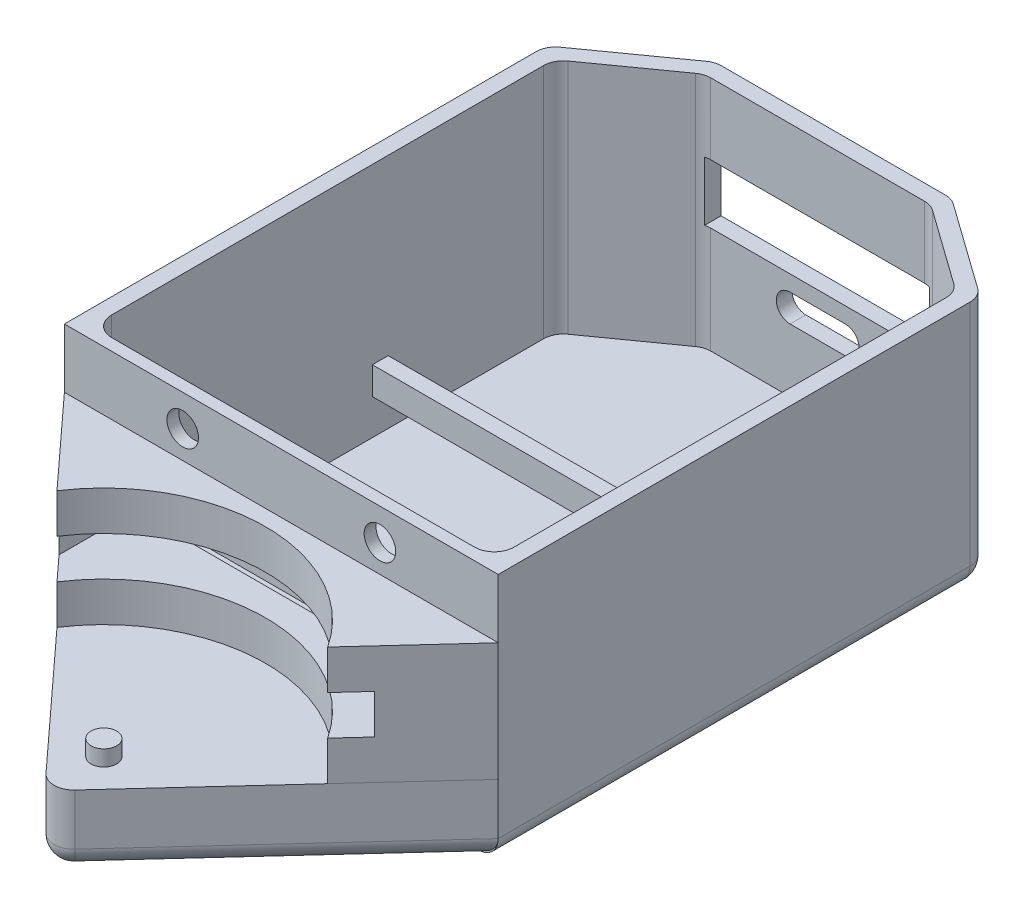
from build123d import *

# Parameters (mm, degrees)
BOSS_EXTRUDE1_DEPTH      = 60
BOSS_EXTRUDE2_DEPTH      = 3
BOSS_EXTRUDE3_START      = 9
SKETCH4_W                = 102
SKETCH4_H                = 4
BOSS_EXTRUDE3_DEPTH      = 7
BOSS_EXTRUDE9_DEPTH      = 15
BOSS_EXTRUDE10_DEPTH     = 18
SKETCH8_W                = 57
SKETCH8_H                = 15
CUT_EXTRUDE1_DEPTH       = 4
SKETCH9_R                = 3.25
BOSS_EXTRUDE11_DEPTH     = 4
SKETCH12_W               = 80
SKETCH12_H               = 10
CUT_EXTRUDE3_DEPTH       = 168.119840074
SKETCH11_R               = 4
CUT_EXTRUDE2_DEPTH       = 4
CUT_EXTRUDE5_START       = -2
CUT_EXTRUDE5_OUTLINE_W   = 100.431415377
CUT_EXTRUDE5_OUTLINE_H   = 30.721398403
CUT_EXTRUDE5_OUTLINE_W_2 = 94.581049407
CUT_EXTRUDE5_OUTLINE_H_2 = 24.546499388
CUT_EXTRUDE5_OUTLINE_W_3 = 3.095406047
CUT_EXTRUDE5_OUTLINE_H_3 = 17.175789186
CUT_EXTRUDE5_OUTLINE_W_4 = 2.748789672
CUT_EXTRUDE5_OUTLINE_H_4 = 2.748789672
CUT_EXTRUDE5_DEPTH       = 2
FILLET1_R                = 5
FILLET2_R                = 5


# Read off the part's stored shape, not the designer's step: Cut-Extrude5
with BuildPart() as part:
    # Sketch2 → Boss-Extrude1 (new body)
    with BuildSketch(Plane(origin=(0, 0, 0), x_dir=(1, 0, 0), z_dir=(0, 1, 0))):
        Polygon((-10.434317904, 0), (49.565682096, 0), (74.565682096, -17.842873744), (74.565682096, -140), (-35.434317904, -140), (-35.434317904, -17.842873744), align=None)
        Polygon((-31.434317904, -19.902301734), (-9.153291369, -4), (48.284655561, -4), (70.565682096, -19.902301734), (70.565682096, -137), (-31.434317904, -137), align=None, mode=Mode.SUBTRACT)
    extrude(amount=BOSS_EXTRUDE1_DEPTH)

    # Sketch3 → Boss-Extrude2 (add)
    with BuildSketch(Plane(origin=(0, 0, 0), x_dir=(1, 0, 0), z_dir=(0, 1, 0))):
        Polygon((-35.434317904, -17.842873744), (-10.434317904, 0), (49.565682096, 0), (74.565682096, -17.842873744), (74.565682096, -140), (-35.434317904, -140), align=None)
    extrude(amount=-BOSS_EXTRUDE2_DEPTH)

    # Sketch4 → Boss-Extrude3 (add)
    with BuildSketch(Plane(origin=(0, 0, 0), x_dir=(1, 0, 0), z_dir=(0, 1, 0)).offset(BOSS_EXTRUDE3_START)):
        with Locations((19.565682096, -63.902301734)):
            Rectangle(SKETCH4_W, SKETCH4_H)
        with Locations((19.565682096, -117.902301734)):
            Rectangle(SKETCH4_W, SKETCH4_H)
    extrude(amount=BOSS_EXTRUDE3_DEPTH)

    # Sketch5 → Boss-Extrude9 (add, symmetric)
    with BuildSketch(Plane(origin=(0, 30, 0), x_dir=(1, 0, 0), z_dir=(0, 1, 0))):
        with BuildLine():
            Line((74.565682096, -140), (-35.434317904, -140))
            Line((-35.434317904, -140), (-14.750780256, -162.563859252))
            ThreePointArc((-14.750780256, -162.563859252), (19.565682096, -144), (53.882144448, -162.563859252))
            Line((53.882144448, -162.563859252), (74.565682096, -140))
        make_face()
    extrude(amount=BOSS_EXTRUDE9_DEPTH, both=True)

    # Sketch8 → Cut-Extrude1 (cut)
    with BuildSketch(Plane(origin=(0, 0, 0), x_dir=(-1, 0, 0), z_dir=(0, 0, -1))):
        with BuildLine():
            Line((-26.565682096, 23), (-12.565682096, 23))
            ThreePointArc((-12.565682096, 23), (-9.065682096, 19.5), (-12.565682096, 16))
            Line((-12.565682096, 16), (-26.565682096, 16))
            ThreePointArc((-26.565682096, 16), (-30.065682096, 19.5), (-26.565682096, 23))
        make_face()
        with Locations((-19.565682096, 34.5)):
            Rectangle(SKETCH8_W, SKETCH8_H)
    extrude(amount=-CUT_EXTRUDE1_DEPTH, mode=Mode.SUBTRACT)

    # Sketch12 → Cut-Extrude3 (cut, through all)
    with BuildSketch(Plane(origin=(0, 0, 137), x_dir=(-1, 0, 0), z_dir=(0, 0, -1))):
        with Locations((-19.565682096, 30)):
            Rectangle(SKETCH12_W, SKETCH12_H)
    extrude(amount=-CUT_EXTRUDE3_DEPTH, mode=Mode.SUBTRACT)

    # Sketch11 → Cut-Extrude2 (cut)
    with BuildSketch(Plane.XY.offset(140)):
        with Locations((-5.434317904, 52)):
            Circle(SKETCH11_R)
        with Locations((44.565682096, 52)):
            Circle(SKETCH11_R)
    extrude(amount=-CUT_EXTRUDE2_DEPTH, mode=Mode.SUBTRACT)

    # Cut-Extrude5 outline → Cut-Extrude5 (cut)
    # profile 1 of 9: a face of its own
    with BuildSketch(Plane.ZY.offset(35.434317904).offset(CUT_EXTRUDE5_START)):
        with Locations((78.641400006, 30.905163363)):
            Rectangle(CUT_EXTRUDE5_OUTLINE_W, CUT_EXTRUDE5_OUTLINE_H)
        with Locations((78.641400007, 31.083776144)):
            Rectangle(CUT_EXTRUDE5_OUTLINE_W_2, CUT_EXTRUDE5_OUTLINE_H_2, mode=Mode.SUBTRACT)
    # profile 2 of 9: a face of its own
    with BuildSketch(Plane.ZY.offset(35.434317904).offset(CUT_EXTRUDE5_START)):
        with BuildLine():
            add(Edge.make_bspline(
                [(102.014179182, 30.804972607), (100.965453341, 29.831756752), (99.635974179, 29.345328611), (98.025382124, 29.345328611)],
                knots=[6, 6, 6, 6, 7, 7, 7, 7], degree=3))
            add(Edge.make_bspline(
                [(103.587088158, 34.617615654), (103.587088158, 33.048877706), (103.062689281, 31.777972719), (102.014179182, 30.804972607)],
                knots=[5, 5, 5, 5, 6, 6, 6, 6], degree=3))
            add(Edge.make_bspline(
                [(103.58708704, 34.620730481), (103.587087139, 34.61969235), (103.587087229, 34.618654074), (103.587088158, 34.617615654)],
                knots=[4.97598677, 4.97598677, 4.97598677, 4.97598677, 4.978108927, 4.978108927, 4.978108927, 4.978108927], degree=3))
            add(Edge.make_bspline(
                [(102.133700704, 38.197436242), (103.101870347, 37.187264435), (103.586356473, 35.995065057), (103.58708704, 34.620730481)],
                knots=[4, 4, 4, 4, 4.999245171, 4.999245171, 4.999245171, 4.999245171], degree=3))
            add(Edge.make_bspline(
                [(102.128179158, 38.203185617), (102.13001779, 38.201267335), (102.131856383, 38.199349044), (102.133700704, 38.197436242)],
                knots=[1.994288685, 1.994288685, 1.994288685, 1.994288685, 1.999981717, 1.999981717, 1.999981717, 1.999981717], degree=3))
            add(Edge.make_bspline(
                [(97.673074101, 39.713712728), (99.674095437, 39.713712728), (101.1592258, 39.210144106), (102.128179158, 38.203185617)],
                knots=[3, 3, 3, 3, 3.998102198, 3.998102198, 3.998102198, 3.998102198], degree=3))
            Line((97.673074101, 39.713712728), (90.639210988, 39.713712728))
            Line((90.639210988, 39.713712728), (90.639210988, 22.537923542))
            Line((90.639210988, 22.537923542), (93.734617034, 22.537923542))
            Line((93.734617034, 22.537923542), (93.734617034, 29.345328611))
            Line((93.734617034, 29.345328611), (98.025382124, 29.345328611))
        make_face()
        with BuildLine():
            add(Edge.make_bspline(
                [(97.396276065, 32.00033165), (98.352520151, 32.00033165), (99.082378107, 32.235095794), (99.585706102, 32.704983653), (100.088962184, 33.174691726), (100.340662139, 33.799698671), (100.340662139, 34.579860661), (100.340662139, 35.284512663), (100.107875638, 35.888484684), (99.642302635, 36.391812679), (99.176729633, 36.895104718), (98.335620297, 37.146768716), (97.119406115, 37.146768716)],
                knots=[0, 0, 0, 0, 1, 2, 3, 4, 5, 6, 7, 8, 9, 10, 10, 10, 10], degree=3))
            Line((97.396276065, 32.00033165), (93.734617034, 32.00033165))
            Line((93.734617034, 32.00033165), (93.734617034, 37.146768716))
            Line((93.734617034, 37.146768716), (97.119406115, 37.146768716))
        make_face(mode=Mode.SUBTRACT)
    # profile 3 of 9: a face of its own
    with BuildSketch(Plane.ZY.offset(35.434317904).offset(CUT_EXTRUDE5_START)):
        with BuildLine():
            add(Edge.make_bspline(
                [(65.573943009, 34.665647509), (65.569318041, 32.467357813), (64.537497421, 30.954091228), (62.47855258, 30.1254906)],
                knots=[9.002246203, 9.002246203, 9.002246203, 9.002246203, 10, 10, 10, 10], degree=3))
            add(Edge.make_bspline(
                [(65.573918689, 34.703780069), (65.57392942, 34.691120938), (65.573937267, 34.678410321), (65.573943009, 34.665647509)],
                knots=[4.921032045, 4.921032045, 4.921032045, 4.921032045, 4.94224861, 4.94224861, 4.94224861, 4.94224861], degree=3))
            add(Edge.make_bspline(
                [(64.128992243, 38.296533837), (65.087180545, 37.367942573), (65.568880795, 36.170497426), (65.573918689, 34.703780069)],
                knots=[8.005040818, 8.005040818, 8.005040818, 8.005040818, 8.994769728, 8.994769728, 8.994769728, 8.994769728], degree=3))
            add(Edge.make_bspline(
                [(64.101522239, 38.322937941), (64.105776715, 38.31884911), (64.114933324, 38.310047778), (64.12408991, 38.301246421), (64.128992243, 38.296533837)],
                knots=[1.986885645, 1.986885645, 1.986885645, 1.986885645, 2, 2.015114051, 2.015114051, 2.015114051, 2.015114051], degree=3))
            add(Edge.make_bspline(
                [(59.546715547, 39.713712728), (61.609510305, 39.713712728), (63.127779201, 39.250061985), (64.101522239, 38.322937941)],
                knots=[7, 7, 7, 7, 7.995629296, 7.995629296, 7.995629296, 7.995629296], degree=3))
            Line((59.546715547, 39.713712728), (52.097619422, 39.713712728))
            Line((52.097619422, 39.713712728), (52.097619422, 22.537923542))
            Line((52.097619422, 22.537923542), (55.193025469, 22.537923542))
            Line((55.193025469, 22.537923542), (55.193025469, 29.596992609))
            Line((55.193025469, 29.596992609), (59.546715547, 29.596992609))
            Line((59.546715547, 29.596992609), (62.214303585, 22.537923542))
            Line((62.214303585, 22.537923542), (65.485863643, 22.537923542))
            Line((65.485863643, 22.537923542), (62.47855258, 30.1254906))
        make_face()
        with BuildLine():
            add(Edge.make_bspline(
                [(61.547406575, 36.549089194), (61.544774543, 36.551371358), (61.542137371, 36.553647928), (61.53949506, 36.555918905)],
                knots=[4, 4, 4, 4, 4.004901839, 4.004901839, 4.004901839, 4.004901839], degree=3))
            add(Edge.make_bspline(
                [(61.555675151, 36.541886852), (61.552926067, 36.544291468), (61.550169875, 36.546692248), (61.547406575, 36.549089194)],
                knots=[3.994851622, 3.994851622, 3.994851622, 3.994851622, 4, 4, 4, 4], degree=3))
            add(Edge.make_bspline(
                [(59.043387552, 32.075841637), (60.158957709, 32.075841637), (60.989423732, 32.310605781), (61.534821578, 32.780493639), (62.08000368, 33.250201713), (62.352702603, 33.896063797), (62.352702603, 34.718259679), (62.352702603, 35.473251672), (62.085523614, 36.080369333), (61.731841977, 36.389090922), (61.555675151, 36.541886852)],
                knots=[0, 0, 0, 0, 1, 2, 3, 4, 5, 6, 7, 7.984530352, 7.984530352, 7.984530352, 7.984530352], degree=3))
            Line((59.043387552, 32.075841637), (55.193025469, 32.075841637))
            Line((55.193025469, 32.075841637), (55.193025469, 37.247448698))
            Line((55.193025469, 37.247448698), (59.29505155, 37.247448698))
            add(Edge.make_bspline(
                [(61.53949506, 36.555918905), (61.363151592, 36.7088292), (61.004951272, 37.016369639), (60.259601734, 37.247448698), (59.29505155, 37.247448698)],
                knots=[8.014669599, 8.014669599, 8.014669599, 8.014669599, 9, 10, 10, 10, 10], degree=3))
        make_face(mode=Mode.SUBTRACT)
    # profile 4 of 9: a face of its own
    with BuildSketch(Plane.ZY.offset(35.434317904).offset(CUT_EXTRUDE5_START)):
        with BuildLine():
            add(Edge.make_bspline(
                [(35.770483195, 24.928733514), (35.76444416, 24.9287202), (35.758393834, 24.928713543), (35.740764821, 24.928713543), (35.728948692, 24.928743585), (35.716883837, 24.928803679)],
                knots=[6, 6, 6, 6, 6.005874855, 6.005874855, 6.017085853, 6.017085853, 6.017085853, 6.017085853], degree=3))
            add(Edge.make_bspline(
                [(33.764226186, 25.029393525), (34.703606375, 24.96215368), (35.293192678, 24.932407287), (35.561903242, 24.929121548), (35.716883837, 24.928803679)],
                knots=[0, 0, 0, 0, 1, 1.779083205, 1.779083205, 1.779083205, 1.779083205], degree=3))
            Line((33.764226186, 25.029393525), (33.764226186, 22.537923542))
            add(Edge.make_bspline(
                [(36.230127644, 22.273747666), (35.174581422, 22.275811331), (34.352683654, 22.3638237), (33.764226186, 22.537923542)],
                knots=[3.011862911, 3.011862911, 3.011862911, 3.011862911, 4, 4, 4, 4], degree=3))
            add(Edge.make_bspline(
                [(36.284591032, 22.273721783), (36.266258992, 22.273727288), (36.248107728, 22.27373548), (36.230127644, 22.273747666)],
                knots=[5.080029658, 5.080029658, 5.080029658, 5.080029658, 5.119087228, 5.119087228, 5.119087228, 5.119087228], degree=3))
            add(Edge.make_bspline(
                [(40.338808796, 23.588591069), (39.48980116, 22.71452299), (38.138442762, 22.276280749), (36.284591032, 22.273721783)],
                knots=[2, 2, 2, 2, 2.997071863, 2.997071863, 2.997071863, 2.997071863], degree=3))
            add(Edge.make_bspline(
                [(40.342674061, 23.592577422), (40.341384496, 23.591249737), (40.340094928, 23.589922073), (40.338808796, 23.588591069)],
                knots=[1.995424966, 1.995424966, 1.995424966, 1.995424966, 1.999968844, 1.999968844, 1.999968844, 1.999968844], degree=3))
            add(Edge.make_bspline(
                [(41.616006282, 27.860550576), (41.616006282, 25.892114552), (41.191419037, 24.469397173), (40.342674061, 23.592577422)],
                knots=[1, 1, 1, 1, 1.998485411, 1.998485411, 1.998485411, 1.998485411], degree=3))
            Line((41.616006282, 27.860550576), (41.616006282, 39.713712728))
            Line((41.616006282, 39.713712728), (38.432505252, 39.713712728))
            Line((38.432505252, 39.713712728), (38.432505252, 27.860550576))
            add(Edge.make_bspline(
                [(35.770483195, 24.928733514), (35.798723222, 24.928713543), (36.050283499, 24.928713543), (36.784122246, 24.928713543), (37.488774249, 25.121587623), (37.866288224, 25.507551526), (38.243766242, 25.893299685), (38.432505252, 26.677740574), (38.432505252, 27.860550576)],
                knots=[1.866313709, 1.866313709, 1.866313709, 1.866313709, 2, 3, 4, 5, 6, 7, 7, 7, 7], degree=3))
        make_face()
    # profile 5 of 9: a face of its own
    with BuildSketch(Plane.ZY.offset(35.434317904).offset(CUT_EXTRUDE5_START)):
        with Locations((46.775028346, 31.125818135)):
            Rectangle(CUT_EXTRUDE5_OUTLINE_W_3, CUT_EXTRUDE5_OUTLINE_H_3)
    # profile 6 of 9: a face of its own
    with BuildSketch(Plane.ZY.offset(35.434317904).offset(CUT_EXTRUDE5_START)):
        Polygon((76.370124796, 39.713712728), (72.55748175, 39.713712728), (66.857412655, 22.537923542), (69.499830696, 22.537923542), (70.846209713, 26.62743654), (77.452290774, 26.62743654), (78.823839786, 22.537923542), (82.13311888, 22.537923542), align=None)
        Polygon((76.621788794, 29.106249611), (71.613750747, 29.106249611), (74.117769771, 36.769290698), align=None, mode=Mode.SUBTRACT)
    # profile 7 of 9: a face of its own
    with BuildSketch(Plane.ZY.offset(35.434317904).offset(CUT_EXTRUDE5_START)):
        with Locations((107.626189251, 31.125818135)):
            Rectangle(CUT_EXTRUDE5_OUTLINE_W_3, CUT_EXTRUDE5_OUTLINE_H_3)
    # profile 8 of 9: a face of its own
    with BuildSketch(Plane.ZY.offset(35.434317904).offset(CUT_EXTRUDE5_START)):
        Polygon((123.518488451, 39.713712728), (111.061354279, 39.713712728), (111.061354279, 37.058709689), (115.628989319, 37.058709689), (115.628989319, 22.537923542), (118.950853411, 22.537923542), (118.950853411, 37.058709689), (123.518488451, 37.058709689), align=None)
    # profile 9 of 9: a face of its own
    with BuildSketch(Plane.ZY.offset(35.434317904).offset(CUT_EXTRUDE5_START)):
        with Locations((86.152701978, 23.909342899)):
            Rectangle(CUT_EXTRUDE5_OUTLINE_W_4, CUT_EXTRUDE5_OUTLINE_H_4)
    extrude(amount=CUT_EXTRUDE5_DEPTH, mode=Mode.SUBTRACT)

    # Fillet1
    # the kernel refuses this fillet: 5 mm, written as the material it adds along each edge
    with BuildSketch(Plane(origin=(-31.434317904, 0, 137), x_dir=(0, 0, -1), z_dir=(0, 1, 0)), Plane(origin=(70.565682096, 0, 137), x_dir=(-1, 0, 0), z_dir=(0, 1, 0))) as fillet1_piece_1:
        with BuildLine():
            CenterArc((FILLET1_R, -FILLET1_R), FILLET1_R, 90, 90)
            Line((0, -FILLET1_R), (0, 0))
            Line((0, 0), (FILLET1_R, 0))
        make_face()
    extrude(amount=60)
    with BuildSketch(Plane(origin=(70.565682096, 0, 19.902301734), x_dir=(0, 0, 1), z_dir=(0, 1, 0))) as fillet1_piece_2:
        with BuildLine():
            CenterArc((FILLET1_R * 0.514856997459, -FILLET1_R), FILLET1_R, 90, 54.483982344)
            Line((-FILLET1_R * 0.299096147287, -FILLET1_R * 0.419069472176), (0, 0))
            Line((0, 0), (FILLET1_R * 0.514856997459, 0))
        make_face()
    extrude(amount=60)
    with BuildSketch(Plane(origin=(48.284655561, 0, 4), x_dir=(0.8139531447464136, 0, 0.5809305278236152), z_dir=(0, 1, 0))) as fillet1_piece_3_section:
        with BuildLine():
            CenterArc((FILLET1_R * 0.320256633699, -FILLET1_R), FILLET1_R, 90, 35.516017656)
            Line((-FILLET1_R * 0.260673894125, -FILLET1_R * 0.186046855254), (0, 0))
            Line((0, 0), (FILLET1_R * 0.320256633699, 0))
        make_face()
    fillet1_piece_3 = extrude(amount=60, mode=Mode.PRIVATE)
    fillet1_piece_3 = split(fillet1_piece_3, bisect_by=Plane(origin=(48.065682096, 13.5, 4.258176316), z_dir=(1, 0, 0)), keep=Keep.TOP, mode=Mode.PRIVATE)
    add(fillet1_piece_3)
    with BuildSketch(Plane(origin=(48.284655561, 0, 4), x_dir=(0.8139531447464136, 0, 0.5809305278236152), z_dir=(0, 1, 0))) as fillet1_piece_4_section:
        with BuildLine():
            CenterArc((FILLET1_R * 0.320256633699, -FILLET1_R), FILLET1_R, 90, 35.516017656)
            Line((-FILLET1_R * 0.260673894125, -FILLET1_R * 0.186046855254), (0, 0))
            Line((0, 0), (FILLET1_R * 0.320256633699, 0))
        make_face()
    fillet1_piece_4 = extrude(amount=64.003207921, mode=Mode.PRIVATE)
    fillet1_piece_4 = split(fillet1_piece_4, bisect_by=Plane(origin=(47.721465876, 27, 4.058262067), z_dir=(0, -1, 0)), keep=Keep.TOP, mode=Mode.PRIVATE)
    add(fillet1_piece_4)
    with BuildSketch(Plane(origin=(48.284655561, -4.003207921, 4), x_dir=(0.8139531447464136, 0, 0.5809305278236152), z_dir=(0, 1, 0))) as fillet1_piece_5_section:
        with BuildLine():
            CenterArc((FILLET1_R * 0.320256633699, -FILLET1_R), FILLET1_R, 90, 35.516017656)
            Line((-FILLET1_R * 0.260673894125, -FILLET1_R * 0.186046855254), (0, 0))
            Line((0, 0), (FILLET1_R * 0.320256633699, 0))
        make_face()
    fillet1_piece_5 = extrude(amount=64.003207921, mode=Mode.PRIVATE)
    fillet1_piece_5 = split(fillet1_piece_5, bisect_by=Plane(origin=(47.721465876, 42, 4.058262067), z_dir=(0, 1, 0)), keep=Keep.TOP, mode=Mode.PRIVATE)
    add(fillet1_piece_5)
    with BuildSketch(Plane(origin=(-9.153291369, 0, 4), x_dir=(1, 0, 0), z_dir=(0, 1, 0))) as fillet1_piece_6_section:
        with BuildLine():
            CenterArc((FILLET1_R * 0.320256633699, -FILLET1_R), FILLET1_R, 90, 35.516017656)
            Line((-FILLET1_R * 0.260673894125, -FILLET1_R * 0.186046855254), (0, 0))
            Line((0, 0), (FILLET1_R * 0.320256633699, 0))
        make_face()
    fillet1_piece_6 = extrude(amount=64.003207921, mode=Mode.PRIVATE)
    fillet1_piece_6 = split(fillet1_piece_6, bisect_by=Plane(origin=(-8.590101683, 27, 4.058262067), z_dir=(0, -1, 0)), keep=Keep.TOP, mode=Mode.PRIVATE)
    add(fillet1_piece_6)
    with BuildSketch(Plane(origin=(-9.153291369, 0, 4), x_dir=(1, 0, 0), z_dir=(0, 1, 0))) as fillet1_piece_7_section:
        with BuildLine():
            CenterArc((FILLET1_R * 0.320256633699, -FILLET1_R), FILLET1_R, 90, 35.516017656)
            Line((-FILLET1_R * 0.260673894125, -FILLET1_R * 0.186046855254), (0, 0))
            Line((0, 0), (FILLET1_R * 0.320256633699, 0))
        make_face()
    fillet1_piece_7 = extrude(amount=60, mode=Mode.PRIVATE)
    fillet1_piece_7 = split(fillet1_piece_7, bisect_by=Plane(origin=(-8.934317904, 34.5, 4.258176316), z_dir=(-1, 0, 0)), keep=Keep.TOP, mode=Mode.PRIVATE)
    add(fillet1_piece_7)
    with BuildSketch(Plane(origin=(-9.153291369, -4.003207921, 4), x_dir=(1, 0, 0), z_dir=(0, 1, 0))) as fillet1_piece_8_section:
        with BuildLine():
            CenterArc((FILLET1_R * 0.320256633699, -FILLET1_R), FILLET1_R, 90, 35.516017656)
            Line((-FILLET1_R * 0.260673894125, -FILLET1_R * 0.186046855254), (0, 0))
            Line((0, 0), (FILLET1_R * 0.320256633699, 0))
        make_face()
    fillet1_piece_8 = extrude(amount=64.003207921, mode=Mode.PRIVATE)
    fillet1_piece_8 = split(fillet1_piece_8, bisect_by=Plane(origin=(-8.590101683, 42, 4.058262067), z_dir=(0, 1, 0)), keep=Keep.TOP, mode=Mode.PRIVATE)
    add(fillet1_piece_8)
    with BuildSketch(Plane(origin=(-31.434317904, 0, 19.902301734), x_dir=(0, 0, 1), z_dir=(0, 1, 0))) as fillet1_piece_9:
        with BuildLine():
            CenterArc((FILLET1_R * 0.514856997459, FILLET1_R), FILLET1_R, 215.516017656, 54.483982344)
            Line((-FILLET1_R * 0.299096147287, FILLET1_R * 0.419069472176), (0, 0))
            Line((0, 0), (FILLET1_R * 0.514856997459, 0))
        make_face()
    extrude(amount=60)
    # the kernel refuses this fillet: 5 mm, written as the material it takes off along each edge
    with BuildSketch(Plane(origin=(69.565682096, 2, 20.417158732), x_dir=(1, 0, 0), z_dir=(0, -1, 0))) as fillet1_2_piece_1_section:
        Polygon((0, 0), (FILLET1_R * 1.02, 0), (FILLET1_R * 1.02, -FILLET1_R * 0.525154137408), (FILLET1_R * 0.59254913838, -FILLET1_R * 0.830232207641), align=None)
    fillet1_2_piece_1 = extrude(amount=FILLET1_R * 1.02, mode=Mode.PRIVATE)
    fillet1_2_piece_1 = fillet1_2_piece_1 - Plane(origin=(69.565682096, 2, 20.417158732), x_dir=(-0.8890811346057277, 0, 0.4577496434604751), z_dir=(0, -1, 0)) * Sphere(FILLET1_R, mode=Mode.PRIVATE)
    add(fillet1_2_piece_1, mode=Mode.SUBTRACT)
    with BuildSketch(Plane(origin=(47.964398928, 2, 5), x_dir=(0.580930527823616, 0, -0.8139531447464129), z_dir=(0, -1, 0))) as fillet1_2_piece_2_section:
        Polygon((0, 0), (FILLET1_R * 1.02, 0), (FILLET1_R * 1.02, -FILLET1_R * 0.326661766373), (FILLET1_R * 0.830232207641, -FILLET1_R * 0.59254913838), align=None)
    fillet1_2_piece_2 = extrude(amount=FILLET1_R * 1.02, mode=Mode.PRIVATE)
    fillet1_2_piece_2 = fillet1_2_piece_2 - Plane(origin=(47.964398928, 2, 5), x_dir=(-0.3049974223281134, 0, 0.9523531762813658), z_dir=(0, -1, 0)) * Sphere(FILLET1_R, mode=Mode.PRIVATE)
    add(fillet1_2_piece_2, mode=Mode.SUBTRACT)
    with BuildSketch(Plane(origin=(-8.833034735, 2, 5), x_dir=(-0.5809305278236158, 0, -0.813953144746413), z_dir=(0, -1, 0))) as fillet1_2_piece_3_section:
        Polygon((0, 0), (FILLET1_R * 1.02, 0), (FILLET1_R * 1.02, FILLET1_R * 0.326661766373), (FILLET1_R * 0.830232207641, FILLET1_R * 0.59254913838), align=None)
    fillet1_2_piece_3 = extrude(amount=FILLET1_R * 1.02, mode=Mode.PRIVATE)
    fillet1_2_piece_3 = fillet1_2_piece_3 - Plane(origin=(-8.833034735, 2, 5), x_dir=(0.3049974223281133, 0, 0.952353176281366), z_dir=(0, -1, 0)) * Sphere(FILLET1_R, mode=Mode.PRIVATE)
    add(fillet1_2_piece_3, mode=Mode.SUBTRACT)
    with BuildSketch(Plane(origin=(-30.434317904, 2, 20.417158732), x_dir=(-0.5809305278236158, 0, -0.813953144746413), z_dir=(0, -1, 0))) as fillet1_2_piece_4_section:
        Polygon((0, 0), (FILLET1_R * 1.02, 0), (FILLET1_R * 1.02, -FILLET1_R * 0.525154137408), (FILLET1_R * 0.59254913838, -FILLET1_R * 0.830232207641), align=None)
    fillet1_2_piece_4 = extrude(amount=FILLET1_R * 1.02, mode=Mode.PRIVATE)
    fillet1_2_piece_4 = fillet1_2_piece_4 - Plane(origin=(-30.434317904, 2, 20.417158732), x_dir=(0.8890811346057277, 0, 0.45774964346047514), z_dir=(0, -1, 0)) * Sphere(FILLET1_R, mode=Mode.PRIVATE)
    add(fillet1_2_piece_4, mode=Mode.SUBTRACT)
    with BuildSketch(Plane(origin=(74.565682096, 66.435712468, 17.842873744), x_dir=(0, 0, 1), z_dir=(0, -1, 0)), Plane(origin=(-35.434317904, 2, 17.842873744), x_dir=(0, 0, 1), z_dir=(0, 1, 0))) as fillet1_2_piece_5:
        with BuildLine():
            CenterArc((FILLET1_R * 0.514856997459, FILLET1_R), FILLET1_R, 215.516017656, 54.483982344)
            Line((-FILLET1_R * 0.299096147287, FILLET1_R * 0.419069472176), (0, 0))
            Line((0, 0), (FILLET1_R * 0.514856997459, 0))
        make_face()
    extrude(amount=64.435712468, mode=Mode.SUBTRACT)
    with BuildSketch(Plane(origin=(49.565682096, 64.003207921, 0), x_dir=(-1, 0, 0), z_dir=(0, -1, 0)), Plane(origin=(-10.434317904, 2, 0), x_dir=(1, 0, 0), z_dir=(0, 1, 0))) as fillet1_2_piece_6:
        with BuildLine():
            CenterArc((FILLET1_R * 0.320256633699, -FILLET1_R), FILLET1_R, 90, 35.516017656)
            Line((-FILLET1_R * 0.260673894125, -FILLET1_R * 0.186046855254), (0, 0))
            Line((0, 0), (FILLET1_R * 0.320256633699, 0))
        make_face()
    extrude(amount=62.003207921, mode=Mode.SUBTRACT)
    with BuildSketch(Plane(origin=(74.565682096, -3, 20.417158732), x_dir=(0, 1, 0), z_dir=(0, 0, 1)), Plane(origin=(-35.434317904, -3, 152.5), x_dir=(0, 1, 0), z_dir=(0, 0, -1))) as fillet1_2_piece_7:
        with BuildLine():
            CenterArc((FILLET1_R, FILLET1_R), FILLET1_R, 180, 90)
            Line((0, FILLET1_R), (0, 0))
            Line((0, 0), (FILLET1_R, 0))
        make_face()
    extrude(amount=132.082841268, mode=Mode.SUBTRACT)
    with BuildSketch(Plane(origin=(-8.833034735, -3, 0), x_dir=(0, 1, 0), z_dir=(1, 0, 0))) as fillet1_2_piece_8:
        with BuildLine():
            CenterArc((FILLET1_R, FILLET1_R), FILLET1_R, 180, 90)
            Line((0, FILLET1_R), (0, 0))
            Line((0, 0), (FILLET1_R, 0))
        make_face()
    extrude(amount=56.797433663, mode=Mode.SUBTRACT)
    with BuildSketch(Plane(origin=(50.869051567, -3, 0.930234276), x_dir=(-0.5809305278236159, 0, 0.8139531447464129), z_dir=(0.8139531447464129, 0, 0.5809305278236159)), Plane(origin=(-33.338970543, -3, 16.347393008), x_dir=(0.5809305278236158, 0, 0.8139531447464129), z_dir=(0.8139531447464129, 0, -0.5809305278236159))) as fillet1_2_piece_9:
        with BuildLine():
            CenterArc((FILLET1_R, -FILLET1_R), FILLET1_R, 90, 90)
            Line((0, -FILLET1_R), (0, 0))
            Line((0, 0), (FILLET1_R, 0))
        make_face()
    extrude(amount=26.538730525, mode=Mode.SUBTRACT)


with BuildPart() as body_2:
    # Sketch7 → Boss-Extrude10 (new body)
    with BuildSketch(Plane(origin=(0, 15, 0), x_dir=(1, 0, 0), z_dir=(0, 1, 0))):
        Polygon((-35.434317904, -140), (19.565682096, -200), (74.565682096, -140), align=None)
    extrude(amount=-BOSS_EXTRUDE10_DEPTH)

    # Sketch9 → Boss-Extrude11 (add)
    with BuildSketch(Plane(origin=(0, 15, 0), x_dir=(1, 0, 0), z_dir=(0, 1, 0))):
        with Locations(Location((19.565682096, -185, 0), (0, 0, 270))):
            Circle(SKETCH9_R)
    extrude(amount=BOSS_EXTRUDE11_DEPTH)

    # Fillet2
    fillet2_edges = [body_2.edges().sort_by_distance(p)[0] for p in [
        (47.065682096, -3, 170),
        (19.565682096, 6, 200),
        (-7.934317904, -3, 170),
    ]]
    fillet(fillet2_edges, radius=FILLET2_R)


solid = Compound([part.part, body_2.part])
